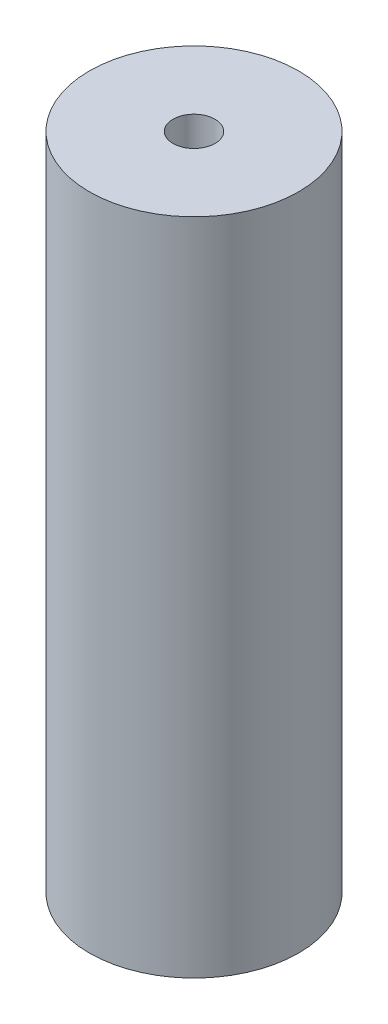
from build123d import *

# Parameters (mm, degrees)
SKETCH1_R                       = 12.7
BOSS_EXTRUDE1_DEPTH             = 80
TAP_DRILL_FOR_1_4_20_TAP1_D     = 5.1054
TAP_DRILL_FOR_1_4_20_TAP1_DEPTH = 10.16
TAP_DRILL_FOR_1_4_20_TAP1_TIP   = 1.533816902
TAP_DRILL_FOR_1_4_20_TAP2_D     = 5.1054
TAP_DRILL_FOR_1_4_20_TAP2_DEPTH = 10.16
TAP_DRILL_FOR_1_4_20_TAP2_TIP   = 1.533816902


with BuildPart() as part:
    # Sketch1 → Boss-Extrude1 (new body)
    with BuildSketch(Plane(origin=(0, 0, 0), x_dir=(1, 0, 0), z_dir=(0, 1, 0))):
        Circle(SKETCH1_R)
    extrude(amount=BOSS_EXTRUDE1_DEPTH)

    # Tap Drill for 1/4-20 Tap1
    with Locations(Plane.XZ):
        with Locations((0, 0)):
            Hole(TAP_DRILL_FOR_1_4_20_TAP1_D / 2, depth=TAP_DRILL_FOR_1_4_20_TAP1_DEPTH)
            with Locations((0, 0, -(TAP_DRILL_FOR_1_4_20_TAP1_DEPTH + TAP_DRILL_FOR_1_4_20_TAP1_TIP / 2))):  # 118° drill point
                Cone(0, TAP_DRILL_FOR_1_4_20_TAP1_D / 2, TAP_DRILL_FOR_1_4_20_TAP1_TIP, mode=Mode.SUBTRACT)

    # Tap Drill for 1/4-20 Tap2
    with Locations(Plane(origin=(0, 80, 0), x_dir=(1, 0, 0), z_dir=(0, 1, 0))):
        with Locations((0, 0)):
            Hole(TAP_DRILL_FOR_1_4_20_TAP2_D / 2, depth=TAP_DRILL_FOR_1_4_20_TAP2_DEPTH)
            with Locations((0, 0, -(TAP_DRILL_FOR_1_4_20_TAP2_DEPTH + TAP_DRILL_FOR_1_4_20_TAP2_TIP / 2))):  # 118° drill point
                Cone(0, TAP_DRILL_FOR_1_4_20_TAP2_D / 2, TAP_DRILL_FOR_1_4_20_TAP2_TIP, mode=Mode.SUBTRACT)


solid = part.part
